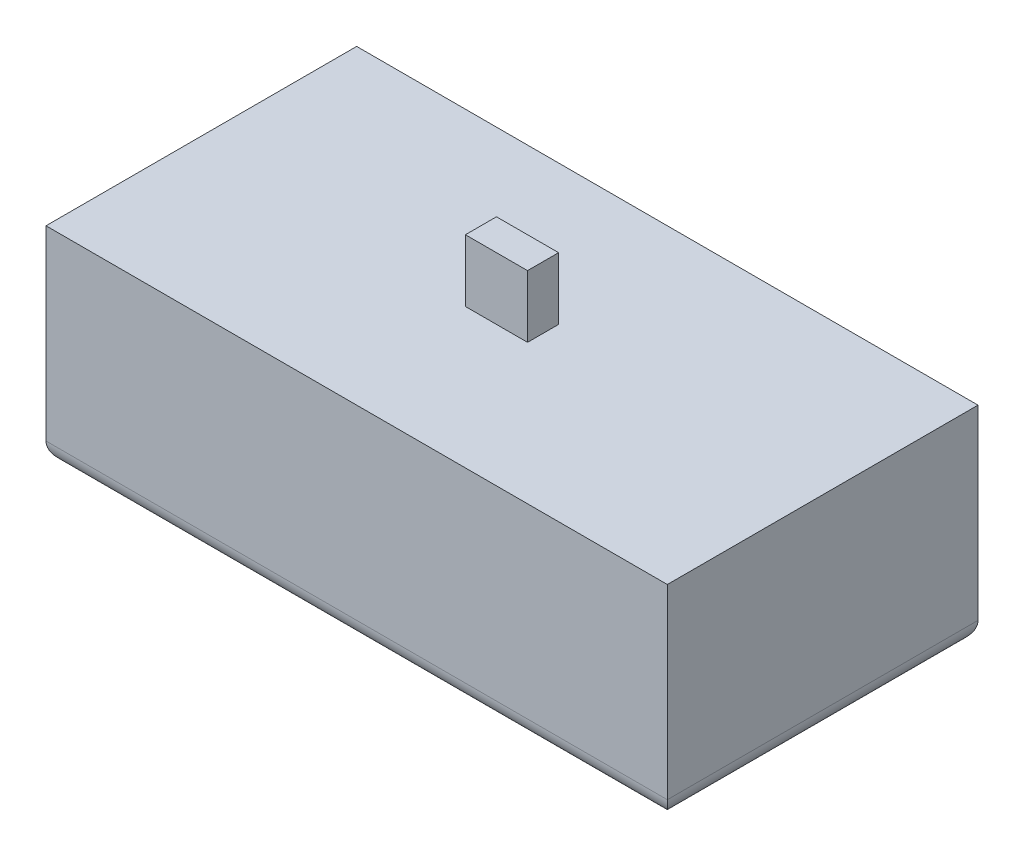
from build123d import *

# Parameters (mm, degrees)
SKETCH1_W           = 300
SKETCH1_H           = 150
BOSS_EXTRUDE1_DEPTH = 100
SKETCH2_W           = 30
SKETCH2_H           = 15
BOSS_EXTRUDE2_DEPTH = 30
FILLET1_R           = 10


with BuildPart() as part:
    # Sketch1 → Boss-Extrude1 (new body)
    with BuildSketch(Plane(origin=(0, 0, 0), x_dir=(1, 0, 0), z_dir=(0, 1, 0))):
        Rectangle(SKETCH1_W, SKETCH1_H)
    extrude(amount=BOSS_EXTRUDE1_DEPTH)

    # Sketch2 → Boss-Extrude2 (add)
    with BuildSketch(Plane(origin=(0, 100, 0), x_dir=(1, 0, 0), z_dir=(0, 1, 0))):
        Rectangle(SKETCH2_W, SKETCH2_H)
    extrude(amount=BOSS_EXTRUDE2_DEPTH)

    # Fillet1
    fillet1_edges = [part.edges().sort_by_distance(p)[0] for p in [
        (0, 0, 75),
        (150, 0, 0),
        (0, 0, -75),
        (-150, 0, 0),
    ]]
    fillet(fillet1_edges, radius=FILLET1_R)


solid = part.part
